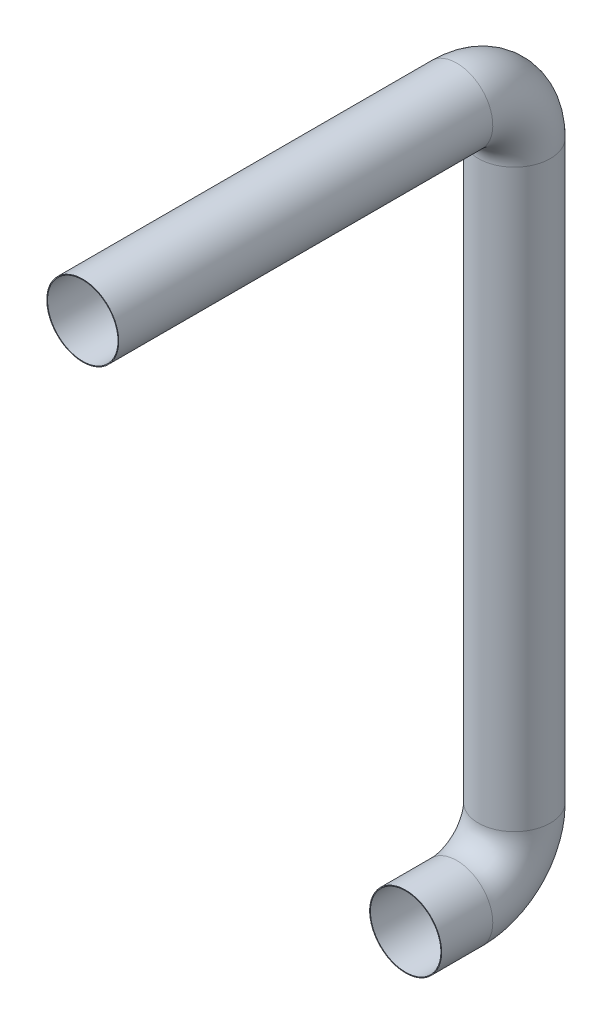
from build123d import *

# Parameters (mm, degrees)
SKETCH31_R   = 25
SKETCH31_R_2 = 24.5


with BuildPart() as part:
    # Sweep1: sweep along a path in Sketch3
    with BuildLine(Plane(origin=(0, 0, 0), x_dir=(0, 0, -1), z_dir=(1, 0, 0))) as sweep1_path:
        Line((0, 0), (260, 0))
        ThreePointArc((260, 0), (288.284271247, -11.715728753), (300, -40))
        Line((300, -40), (300, -440))
        ThreePointArc((300, -440), (288.284271247, -468.284271247), (260, -480))
        Line((260, -480), (224.43, -480))
    # Sketch31 → Sweep1 (sweep)
    with BuildSketch(Plane.XY):
        Circle(SKETCH31_R)
        Circle(SKETCH31_R_2, mode=Mode.SUBTRACT)
    sweep(path=sweep1_path.line)


solid = part.part
